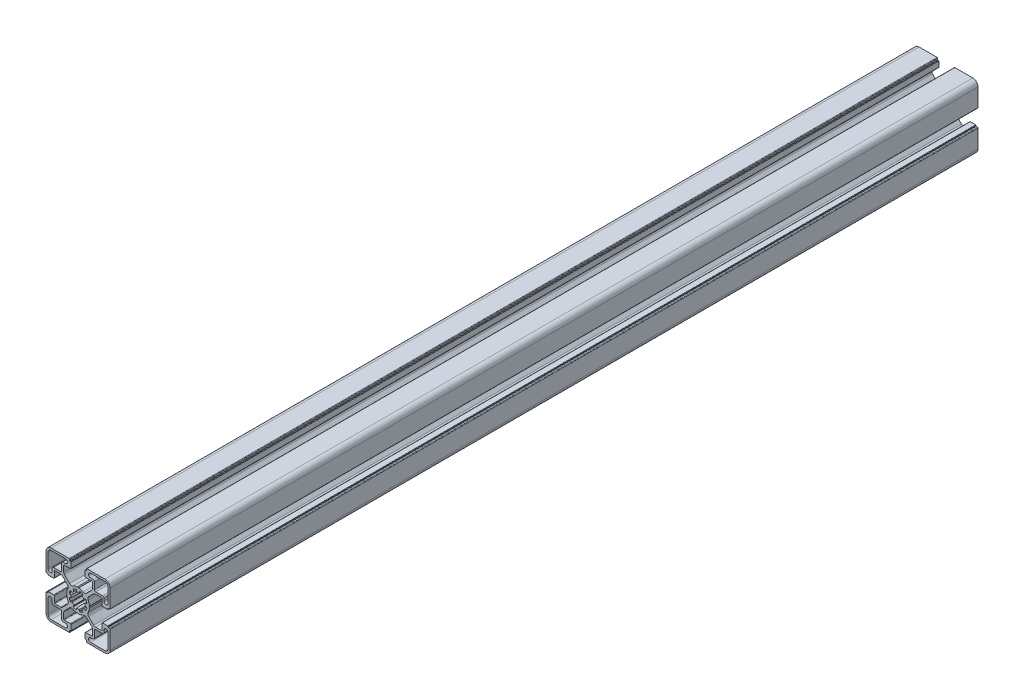
from build123d import *

# Parameters (mm, degrees)
BOSS_EXTRUDE1_DEPTH      = 304.8
FILLET4_R                = 1.885
FILLET5_R                = 0.377
DELETEFACE1_START        = -304.8
DELETEFACE1_DEPTH        = 609.6
CUT_EXTRUDE1_START       = -304.8
CUT_EXTRUDE1_DEPTH       = 609.6
CIRPATTERN2_COUNT        = 3
CIRPATTERN2_ANGLE        = 180
FILLET2_R                = 0.377
FILLET3_R                = 0.1885
CUT_EXTRUDE2_DEPTH       = 611.429897695
CUT_EXTRUDE2_DEPTH_BACK  = 611.429897695
SKETCH5_R                = 6.375
BOSS_EXTRUDE2_DEPTH      = 304.8
FILLET6_R                = 0.377
CIRPATTERN1_COUNT        = 8
FILLET6_OF_CIRPATTERN1_R = 0.377
CUT_EXTRUDE3_DEPTH       = 307.456424309
CUT_EXTRUDE3_DEPTH_BACK  = 307.456424309


# Read off the part's stored shape, not the designer's step: DeleteFace1
with BuildPart() as part:
    # Sketch3 → Boss-Extrude1 (new, symmetric)
    with BuildSketch(Plane.XY):
        with BuildLine():
            Line((0, -8), (0, -5))
            ThreePointArc((0, -5), (3.535533906, -3.535533906), (5, 0))
            Line((5, 0), (8, 0))
            ThreePointArc((8, 0), (7.57237156, -2.58054044), (6.335202759, -4.885202759))
            Line((6.335202759, -4.885202759), (11.5, -10.05))
            Line((11.5, -10.05), (16.7, -10.05))
            Line((16.7, -10.05), (16.7, -5))
            Line((16.7, -5), (21.05, -5))
            Line((21.05, -5), (21.05, 0))
            Line((21.05, 0), (22.5, 0))
            Line((22.5, 0), (22.5, -18.875))
            ThreePointArc((22.5, -18.875), (21.438262082, -21.438262082), (18.875, -22.5))
            Line((18.875, -22.5), (0, -22.5))
            Line((0, -22.5), (0, -21.05))
            Line((0, -21.05), (5, -21.05))
            Line((5, -21.05), (5, -16.7))
            Line((5, -16.7), (10.05, -16.7))
            Line((10.05, -16.7), (10.05, -11.5))
            Line((10.05, -11.5), (4.885202759, -6.335202759))
            ThreePointArc((4.885202759, -6.335202759), (2.58054044, -7.57237156), (0, -8))
        make_face()
        with BuildLine():
            Line((18.15, -8.79375), (18.15, -10.5575))
            ThreePointArc((18.15, -10.5575), (17.873948141, -11.223948141), (17.2075, -11.5))
            Line((17.2075, -11.5), (12.4425, -11.5))
            ThreePointArc((12.4425, -11.5), (11.776051859, -11.776051859), (11.5, -12.4425))
            Line((11.5, -12.4425), (11.5, -17.2075))
            ThreePointArc((11.5, -17.2075), (11.223948141, -17.873948141), (10.5575, -18.15))
            Line((10.5575, -18.15), (8.79375, -18.15))
            ThreePointArc((8.79375, -18.15), (7.34375, -19.6), (8.79375, -21.05))
            Line((8.79375, -21.05), (18.875, -21.05))
            ThreePointArc((18.875, -21.05), (20.412957249, -20.412957249), (21.05, -18.875))
            Line((21.05, -18.875), (21.05, -8.79375))
            ThreePointArc((21.05, -8.79375), (19.6, -7.34375), (18.15, -8.79375))
        make_face(mode=Mode.SUBTRACT)
    extrude(amount=BOSS_EXTRUDE1_DEPTH, both=True)

    # Fillet4
    fillet4_edges = [part.edges().sort_by_distance(p)[0] for p in [
        (10.05, -11.5, 0),
        (4.885202759, -6.335202759, 0),
        (6.335202759, -4.885202759, 0),
        (11.5, -10.05, 0),
    ]]
    fillet(fillet4_edges, radius=FILLET4_R)

    # Fillet5
    fillet5_edges = [part.edges().sort_by_distance(p)[0] for p in [
        (5, -21.05, 0),
        (5, -16.7, 0),
        (10.05, -16.7, 0),
        (16.7, -10.05, 0),
        (16.7, -5, 0),
        (21.05, -5, 0),
    ]]
    fillet(fillet5_edges, radius=FILLET5_R)

    # Mirror1: part across plane


with BuildPart() as part_1:
    add(part.part)
    add(part.part.mirror(Plane.ZX))

    # DeleteFace1 outline → DeleteFace1 (cut)
    with BuildSketch(Plane.XY.offset(DELETEFACE1_START)):
        with BuildLine():
            ThreePointArc((4.623, 21.05), (4.889579257, 20.939579257), (5, 20.673))
            Line((5, 20.673), (5, 21.05))
            Line((5, 21.05), (4.623, 21.05))
        make_face()
    extrude(amount=DELETEFACE1_DEPTH, mode=Mode.SUBTRACT)

    # Sketch4 → Cut-Extrude1 (cut)
    with BuildSketch(Plane.XY.offset(CUT_EXTRUDE1_START)):
        Polygon((5.85, 21.05), (5.85, 22.5), (0, 22.5), (-5.85, 22.5), (-5.85, 21.05), (-5, 21.05), (-5, 16.7), (5, 16.7), (5, 21.05), align=None)
    cut_extrude1 = extrude(amount=CUT_EXTRUDE1_DEPTH, mode=Mode.SUBTRACT)

    # CirPattern2: Cut-Extrude1 ×3 about axis
    cirpattern2_axis = Axis((0, 0, 269.8), (0, 0, -1))
    for i in range(1, CIRPATTERN2_COUNT):
        add(cut_extrude1.rotate(cirpattern2_axis, i * CIRPATTERN2_ANGLE / (CIRPATTERN2_COUNT - 1)), mode=Mode.SUBTRACT)

    # Fillet2
    fillet2_edges = [part_1.edges().sort_by_distance(p)[0] for p in [
        (5.85, 22.5, 0),
        (22.5, 5.85, 0),
        (22.5, -5.85, 0),
        (5.85, -22.5, 0),
    ]]
    fillet(fillet2_edges, radius=FILLET2_R)

    # Fillet3
    fillet3_edges = [part_1.edges().sort_by_distance(p)[0] for p in [
        (5, 21.05, 0),
        (5.85, 21.05, 0),
        (21.05, -5, 0),
        (21.05, -5.85, 0),
        (21.05, 5, 0),
        (21.05, 5.85, 0),
        (5, -21.05, 0),
        (5.85, -21.05, 0),
    ]]
    fillet(fillet3_edges, radius=FILLET3_R)

    # Mirror2: part across plane


with BuildPart() as part_2:
    add(part_1.part)
    add(part_1.part.mirror(Plane(origin=(0, 0, 0), x_dir=(0, 0, 1), z_dir=(1, 0, 0))))

    # Sketch5 → Cut-Extrude2 (cut, two sides: drawn at the far end of the back side and taken through both)
    with BuildSketch(Plane.XY.offset(304.8).offset(-CUT_EXTRUDE2_DEPTH_BACK)):
        Circle(SKETCH5_R)
        Polygon((-0.580185128, 8), (0.580185128, 8), (0, 7.59375), align=None)
        Polygon((-8, 0.580185128), (-8, -0.580185128), (-7.59375, 0), align=None)
        Polygon((8, 0.580185128), (8, -0.580185128), (7.59375, 0), align=None)
        Polygon((-0.580185128, -8), (0.580185128, -8), (0, -7.59375), align=None)
    extrude(amount=CUT_EXTRUDE2_DEPTH + CUT_EXTRUDE2_DEPTH_BACK, mode=Mode.SUBTRACT)

    # Sketch6 → Boss-Extrude2 (add, symmetric)
    with BuildSketch(Plane.XY):
        with BuildLine():
            Line((-0.97545161, -4.903926402), (-1.243700803, -6.252506163))
            ThreePointArc((-1.243700803, -6.252506163), (0, -6.375), (1.243700803, -6.252506163))
            Line((1.243700803, -6.252506163), (0.97545161, -4.903926402))
            ThreePointArc((0.97545161, -4.903926402), (0, -5), (-0.97545161, -4.903926402))
        make_face()
    boss_extrude2 = extrude(amount=BOSS_EXTRUDE2_DEPTH, both=True)

    # Fillet6
    fillet6_edges = [part_2.edges().sort_by_distance(p)[0] for p in [
        (-1.243700803, -6.252506163, 0),
        (1.243700803, -6.252506163, 0),
    ]]
    fillet(fillet6_edges, radius=FILLET6_R)

    # CirPattern1: Boss-Extrude2 ×8 about axis
    cirpattern1_axis = Axis((0, 0, 0), (0, 0, 1))
    for i in range(1, CIRPATTERN1_COUNT):
        add(boss_extrude2.rotate(cirpattern1_axis, i * 360 / CIRPATTERN1_COUNT))

    # Fillet6 of CirPattern1
    fillet6_of_cirpattern1_edges = [part_2.edges().sort_by_distance(p)[0] for p in [
        (3.541760235, -5.300618778, 0),
        (5.300618778, -3.541760235, 0),
        (6.252506163, -1.243700803, 0),
        (6.252506163, 1.243700803, 0),
        (5.300618778, 3.541760235, 0),
        (3.541760235, 5.300618778, 0),
        (1.243700803, 6.252506163, 0),
        (-1.243700803, 6.252506163, 0),
        (-3.541760235, 5.300618778, 0),
        (-5.300618778, 3.541760235, 0),
        (-6.252506163, 1.243700803, 0),
        (-6.252506163, -1.243700803, 0),
        (-5.300618778, -3.541760235, 0),
        (-3.541760235, -5.300618778, 0),
    ]]
    fillet(fillet6_of_cirpattern1_edges, radius=FILLET6_OF_CIRPATTERN1_R)

    # Sketch7 → Cut-Extrude3 (cut, two sides: drawn at the far end of the back side and taken through both)
    with BuildSketch(Plane.XY.offset(-CUT_EXTRUDE3_DEPTH_BACK)):
        Polygon((-7.031875, 16.7), (-6.596875, 17.135), (-6.161875, 16.7), align=None)
    extrude(amount=CUT_EXTRUDE3_DEPTH + CUT_EXTRUDE3_DEPTH_BACK, mode=Mode.SUBTRACT)


solid = part_2.part
